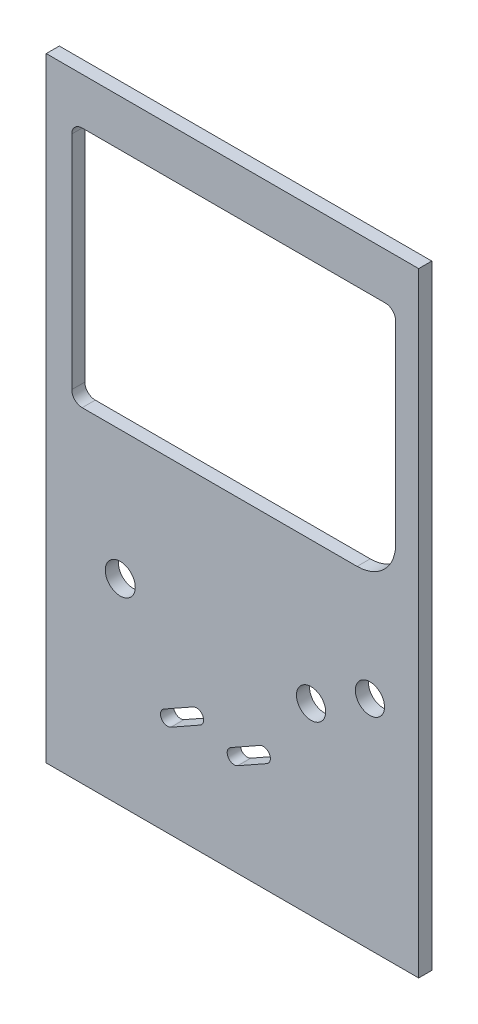
from build123d import *

# Parameters (mm, degrees)
SKETCH1_W           = 89.294272306
SKETCH1_H           = 147.294272306
SKETCH1_R           = 3.6
SKETCH1_R_2         = 3.5
BOSS_EXTRUDE1_DEPTH = 3.14


with BuildPart() as part:
    # Sketch1 → Boss-Extrude1 (new body)
    with BuildSketch(Plane.XY):
        Rectangle(SKETCH1_W, SKETCH1_H)
        with BuildLine():
            Line((39.139308268, 60.005147218), (39.139308268, 13.683084381))
            ThreePointArc((39.139308268, 13.683084381), (36.430045993, 7.142346655), (29.889308268, 4.433084381))
            Line((29.889308268, 4.433084381), (-36.027217939, 4.433084381))
            ThreePointArc((-36.027217939, 4.433084381), (-37.794984892, 5.165317428), (-38.527217939, 6.933084381))
            Line((-38.527217939, 6.933084381), (-38.527217939, 60.005147218))
            ThreePointArc((-38.527217939, 60.005147218), (-37.794984892, 61.772914171), (-36.027217939, 62.505147218))
            Line((-36.027217939, 62.505147218), (36.639308268, 62.505147218))
            ThreePointArc((36.639308268, 62.505147218), (38.40707522, 61.772914171), (39.139308268, 60.005147218))
        make_face(mode=Mode.SUBTRACT)
        with BuildLine():
            ThreePointArc((-14.745996033, -51.265124074), (-17.044884469, -50.621435312), (-16.401195707, -48.322546875))
            Line((-16.401195707, -48.322546875), (-9.42859141, -44.400456958))
            ThreePointArc((-9.42859141, -44.400456958), (-7.129702973, -45.04414572), (-7.773391736, -47.343034157))
            Line((-7.773391736, -47.343034157), (-14.745996033, -51.265124074))
        make_face(mode=Mode.SUBTRACT)
        with Locations((-26.900831216, -26.517202566)):
            Circle(SKETCH1_R, mode=Mode.SUBTRACT)
        with BuildLine():
            ThreePointArc((1.254003967, -51.265124074), (-1.044884469, -50.621435312), (-0.401195707, -48.322546875))
            Line((-0.401195707, -48.322546875), (6.57140859, -44.400456958))
            ThreePointArc((6.57140859, -44.400456958), (8.870297027, -45.04414572), (8.226608264, -47.343034157))
            Line((8.226608264, -47.343034157), (1.254003967, -51.265124074))
        make_face(mode=Mode.SUBTRACT)
        with Locations((18.849494268, -29.546234455)):
            Circle(SKETCH1_R_2, mode=Mode.SUBTRACT)
        with Locations((32.960239, -21.476652312)):
            Circle(SKETCH1_R_2, mode=Mode.SUBTRACT)
    extrude(amount=BOSS_EXTRUDE1_DEPTH)


solid = part.part
